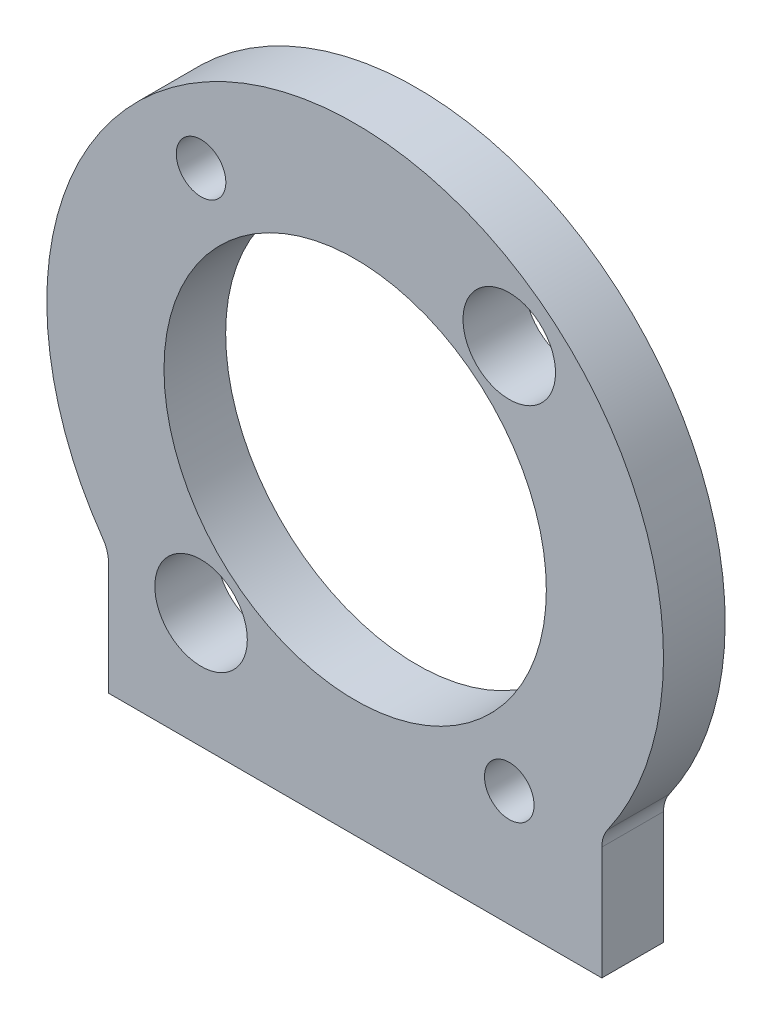
from build123d import *

# Parameters (mm, degrees)
SKETCH1_R           = 19.685
SKETCH1_R_2         = 2.5527
SKETCH1_R_3         = 4.7625
BOSS_EXTRUDE1_DEPTH = 6.35


with BuildPart() as part:
    # Sketch1 → Boss-Extrude1 (new body)
    with BuildSketch(Plane.XY):
        with BuildLine():
            Line((0, 0), (-50.8, 0))
            Line((-50.8, 0), (-50.8, 11.669536858))
            ThreePointArc((-50.8, 11.669536858), (-50.947756279, 12.626835377), (-51.377272727, 13.495033507))
            ThreePointArc((-51.377272727, 13.495033507), (-25.4, 63.5), (0.577272727, 13.495033507))
            ThreePointArc((0.577272727, 13.495033507), (0.147756279, 12.626835377), (0, 11.669536858))
            Line((0, 11.669536858), (0, 0))
        make_face()
        with Locations((-25.4, 31.75)):
            Circle(SKETCH1_R, mode=Mode.SUBTRACT)
        with Locations((-41.267254208, 51.58406776)):
            Circle(SKETCH1_R_2, mode=Mode.SUBTRACT)
        with Locations((-9.532745792, 51.58406776)):
            Circle(SKETCH1_R_3, mode=Mode.SUBTRACT)
        with Locations((-9.532745792, 11.91593224)):
            Circle(SKETCH1_R_2, mode=Mode.SUBTRACT)
        with Locations((-41.267254208, 11.91593224)):
            Circle(SKETCH1_R_3, mode=Mode.SUBTRACT)
    extrude(amount=BOSS_EXTRUDE1_DEPTH)


solid = part.part
